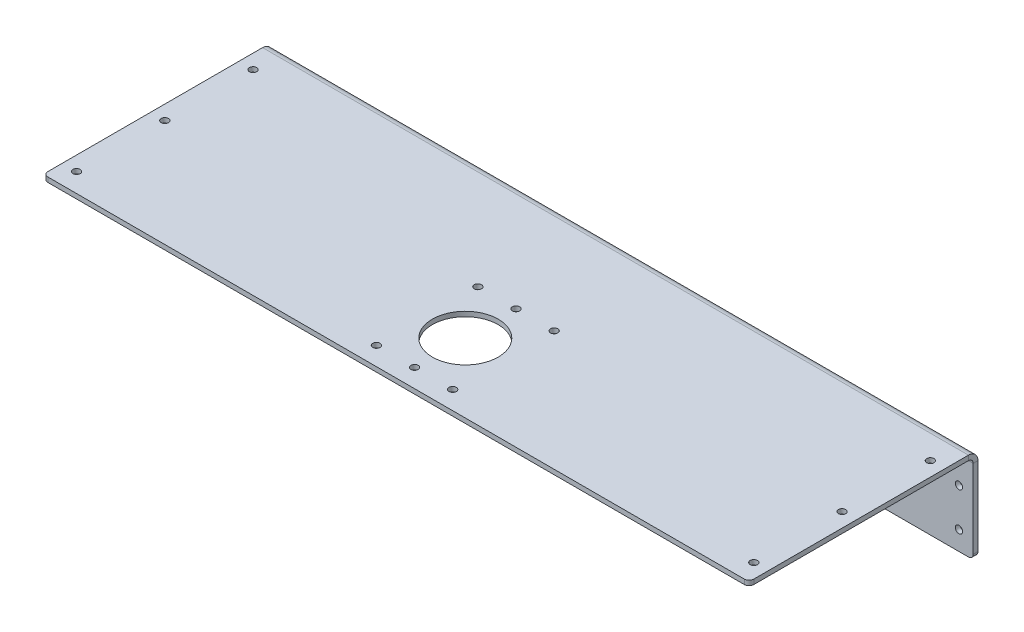
from build123d import *

# Parameters (mm, degrees)
BASE_FLANGE1_DEPTH = 469.9
SKETCH6_R          = 21.9075
CUT_EXTRUDE1_DEPTH = 3.175
SKETCH7_R          = 2.4257
CUT_EXTRUDE2_DEPTH = 510.278313523
SKETCH8_R          = 2.4257
CUT_EXTRUDE3_DEPTH = 510.278313523
SKETCH9_R          = 2.4257
CUT_EXTRUDE4_DEPTH = 510.278313523
FILLET1_R          = 3.175
SKETCH10_W         = 152.4
SKETCH10_H         = 61.9125
CUT_EXTRUDE5_DEPTH = 510.278313523
FILLET2_R          = 3.175


# Sheet-metal steps are written as plain solids
with BuildPart() as part:
    # Sketch1 → Base-Flange1 (new body)
    with BuildSketch(Plane(origin=(0, 0, 0), x_dir=(0, 0, -1), z_dir=(1, 0, 0))):
        with BuildLine():
            Line((0, 0), (146.05, 0))
            ThreePointArc((146.05, 0), (150.540128061, 1.859871939), (152.4, 6.35))
            Line((152.4, 6.35), (152.4, 117.475))
            ThreePointArc((152.4, 117.475), (150.540128061, 121.965128061), (146.05, 123.825))
            Line((146.05, 123.825), (0, 123.825))
            Line((0, 123.825), (0, 120.65))
            Line((0, 120.65), (146.05, 120.65))
            ThreePointArc((146.05, 120.65), (148.29506403, 119.72006403), (149.225, 117.475))
            Line((149.225, 117.475), (149.225, 6.35))
            ThreePointArc((149.225, 6.35), (148.29506403, 4.10493597), (146.05, 3.175))
            Line((146.05, 3.175), (0, 3.175))
            Line((0, 3.175), (0, 0))
        make_face()
    extrude(amount=BASE_FLANGE1_DEPTH)

    # Sketch6 → Cut-Extrude1 (cut)
    with BuildSketch(Plane(origin=(0, 123.825, 0), x_dir=(1, 0, 0), z_dir=(0, 1, 0))):
        with Locations(Location((234.95, 46.0375, 0), (0, 0, 270))):
            Circle(SKETCH6_R)
    extrude(amount=-CUT_EXTRUDE1_DEPTH, mode=Mode.SUBTRACT)

    # Sketch7 → Cut-Extrude2 (cut, through all)
    with BuildSketch(Plane(origin=(0, 123.825, 0), x_dir=(1, 0, 0), z_dir=(0, 1, 0))):
        with Locations(Location((234.95, 12.2555, 0), (0, 0, 270))):
            Circle(SKETCH7_R)
        with Locations(Location((234.95, 79.8195, 0), (0, 0, 270))):
            Circle(SKETCH7_R)
        with Locations(Location((209.55, 12.2555, 0), (0, 0, 270))):
            Circle(SKETCH7_R)
        with Locations(Location((260.35, 12.2555, 0), (0, 0, 270))):
            Circle(SKETCH7_R)
        with Locations(Location((260.35, 79.8195, 0), (0, 0, 270))):
            Circle(SKETCH7_R)
        with Locations(Location((209.55, 79.8195, 0), (0, 0, 270))):
            Circle(SKETCH7_R)
    extrude(amount=-CUT_EXTRUDE2_DEPTH, mode=Mode.SUBTRACT)

    # Sketch8 → Cut-Extrude3 (cut, through all)
    with BuildSketch(Plane(origin=(0, 123.825, 0), x_dir=(1, 0, 0), z_dir=(0, 1, 0))):
        with Locations(Location((460.375, 12.7, 0), (0, 0, 270))):
            Circle(SKETCH8_R)
        with Locations(Location((460.375, 71.4375, 0), (0, 0, 270))):
            Circle(SKETCH8_R)
        with Locations(Location((460.375, 130.175, 0), (0, 0, 270))):
            Circle(SKETCH8_R)
        with Locations(Location((9.525, 130.175, 0), (0, 0, 270))):
            Circle(SKETCH8_R)
        with Locations(Location((9.525, 71.4375, 0), (0, 0, 270))):
            Circle(SKETCH8_R)
        with Locations(Location((9.525, 12.7, 0), (0, 0, 270))):
            Circle(SKETCH8_R)
    extrude(amount=-CUT_EXTRUDE3_DEPTH, mode=Mode.SUBTRACT)

    # Sketch9 → Cut-Extrude4 (cut, through all)
    with BuildSketch(Plane(origin=(0, 0, -152.4), x_dir=(-1, 0, 0), z_dir=(0, 0, -1))):
        with Locations((-460.375, 74.6125)):
            Circle(SKETCH9_R)
        with Locations((-460.375, 49.2125)):
            Circle(SKETCH9_R)
        with Locations((-9.525, 49.2125)):
            Circle(SKETCH9_R)
        with Locations((-9.525, 74.6125)):
            Circle(SKETCH9_R)
        with Locations((-460.375, 100.0125)):
            Circle(SKETCH9_R)
        with Locations((-460.375, 23.8125)):
            Circle(SKETCH9_R)
        with Locations((-9.525, 23.8125)):
            Circle(SKETCH9_R)
        with Locations((-9.525, 100.0125)):
            Circle(SKETCH9_R)
    extrude(amount=-CUT_EXTRUDE4_DEPTH, mode=Mode.SUBTRACT)

    # Fillet1
    fillet1_edges = [part.edges().sort_by_distance(p)[0] for p in [
        (0, 1.5875, 0),
        (0, 122.2375, 0),
        (469.9, 1.5875, 0),
        (469.9, 122.2375, 0),
    ]]
    fillet(fillet1_edges, radius=FILLET1_R)

    # Sketch10 → Cut-Extrude5 (cut, through all)
    with BuildSketch(Plane(origin=(469.9, 0, 0), x_dir=(0, 0, -1), z_dir=(1, 0, 0))):
        with Locations((76.2, 30.95625)):
            Rectangle(SKETCH10_W, SKETCH10_H)
    extrude(amount=-CUT_EXTRUDE5_DEPTH, mode=Mode.SUBTRACT)

    # Fillet2
    fillet2_edges = [part.edges().sort_by_distance(p)[0] for p in [
        (469.9, 61.9125, -150.8125),
        (0, 61.9125, -150.8125),
    ]]
    fillet(fillet2_edges, radius=FILLET2_R)


solid = part.part
